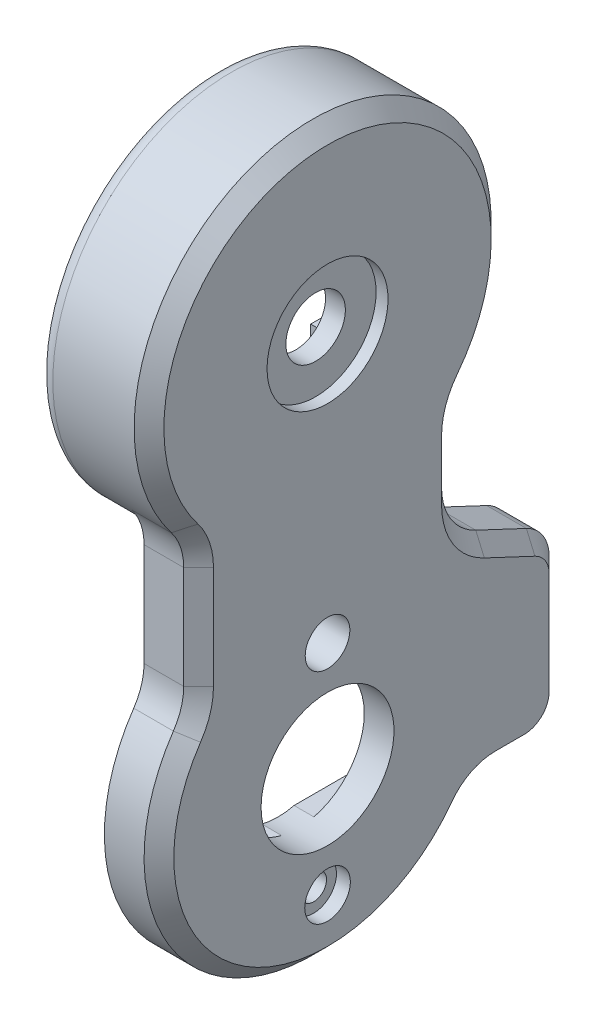
from build123d import *

# Parameters (mm, degrees)
BOSS_EXTRUDE1_START  = 55.1
BOSS_EXTRUDE1_DEPTH  = 5.5
BOSS_EXTRUDE2_START  = 55
BOSS_EXTRUDE2_DEPTH  = 0.6
BOSS_EXTRUDE3_START  = 49.4
SKETCH3_R            = 18
SKETCH3_R_2          = 16.3
BOSS_EXTRUDE3_DEPTH  = 6.2
CHAMFER1_SIZE        = 1.5
FILLET1_R            = 1.5
BOSS_EXTRUDE4_START  = -55.3
SKETCH4_W            = 2.3
SKETCH4_H            = 23
BOSS_EXTRUDE4_DEPTH  = 6.6
BOSS_EXTRUDE5_START  = -63.5
SKETCH5_W            = 2.3
SKETCH5_H            = 6.6
BOSS_EXTRUDE5_DEPTH  = 23
BOSS_EXTRUDE6_START  = 55.1
SKETCH6_R            = 4.6
BOSS_EXTRUDE6_DEPTH  = 2.3
BOSS_EXTRUDE7_START  = 59.4
SKETCH7_R            = 6.1
BOSS_EXTRUDE7_DEPTH  = 1.7
BOSS_EXTRUDE8_START  = 57.3
SKETCH8_R            = 3
BOSS_EXTRUDE8_DEPTH  = 2.2
BOSS_EXTRUDE9_START  = -52.9
SKETCH9_W            = 2.3
SKETCH9_H            = 3.4
BOSS_EXTRUDE9_DEPTH  = 1.8
BOSS_EXTRUDE10_START = -62
SKETCH10_W           = 2.3
SKETCH10_H           = 1.8
BOSS_EXTRUDE10_DEPTH = 3.4
BOSS_EXTRUDE11_START = -52.9
SKETCH11_W           = 2.3
SKETCH11_H           = 3.4
BOSS_EXTRUDE11_DEPTH = 1.8
BOSS_EXTRUDE12_START = -45.4
SKETCH12_W           = 2.3
SKETCH12_H           = 1.8
BOSS_EXTRUDE12_DEPTH = 3.4
BOSS_EXTRUDE13_START = -56
SKETCH13_W           = 6.3
SKETCH13_H           = 3.098417801
BOSS_EXTRUDE13_DEPTH = 8
BOSS_EXTRUDE14_START = -44.775
SKETCH14_W           = 4.1
SKETCH14_H           = 2
BOSS_EXTRUDE14_DEPTH = 2.9
BOSS_EXTRUDE15_START = -72.925
SKETCH15_W           = 4.1
SKETCH15_H           = 2
BOSS_EXTRUDE15_DEPTH = 2.9
BOSS_EXTRUDE16_START = -69.1
SKETCH16_W           = 2.1
SKETCH16_H           = 13
BOSS_EXTRUDE16_DEPTH = 23.4
BOSS_EXTRUDE17_START = 55.5
SKETCH17_R           = 6.7
BOSS_EXTRUDE17_DEPTH = 5.6
BOSS_EXTRUDE18_START = 55.5
SKETCH18_R           = 2.25
BOSS_EXTRUDE18_DEPTH = 5.6
BOSS_EXTRUDE19_START = 59.2
SKETCH19_R           = 2.3
BOSS_EXTRUDE19_DEPTH = 1.9
BOSS_EXTRUDE20_START = 55.5
SKETCH20_R           = 1.3
BOSS_EXTRUDE20_DEPTH = 3.75
BOSS_EXTRUDE21_START = -44.6
SKETCH21_W           = 3.1
SKETCH21_H           = 4.1
BOSS_EXTRUDE21_DEPTH = 2.2
BOSS_EXTRUDE22_START = -5.75
BOSS_EXTRUDE22_DEPTH = 3.5
BOSS_EXTRUDE23_START = -61.6
SKETCH23_W           = 3.1
SKETCH23_H           = 4.1
BOSS_EXTRUDE23_DEPTH = 2.2
BOSS_EXTRUDE24_START = -5.75
BOSS_EXTRUDE24_DEPTH = 3.5


with BuildPart() as part:
    # Sketch1 → Boss-Extrude1 (new body)
    with BuildSketch(Plane(origin=(0, 0, 0), x_dir=(0, 0, -1), z_dir=(1, 0, 0)).offset(BOSS_EXTRUDE1_START)):
        with BuildLine():
            Line((39, 3.337121701), (39, -7.038518603))
            ThreePointArc((39, -7.038518603), (38.733198515, -8.807822077), (37.956521739, -10.41977462))
            ThreePointArc((37.956521739, -10.41977462), (42.18950583, -33.883594784), (65.719936005, -30.038095238))
            ThreePointArc((65.719936005, -30.038095238), (67.138131249, -28.832955071), (68.948156242, -28.4))
            Line((68.948156242, -28.4), (71.85, -28.4))
            ThreePointArc((71.85, -28.4), (74.678427125, -27.228427125), (75.85, -24.4))
            Line((75.85, -24.4), (75.85, -14.139667829))
            ThreePointArc((75.85, -14.139667829), (75.226856881, -11.995644133), (73.551581196, -10.519637244))
            Line((73.551581196, -10.519637244), (68.447628205, -8.120544133))
            ThreePointArc((68.447628205, -8.120544133), (65.934714679, -5.9065338), (65, -2.690498257))
            Line((65, -2.690498257), (65, 3.337121701))
            ThreePointArc((65, 3.337121701), (65.321091654, 5.273613374), (66.25, 7.002841276))
            ThreePointArc((66.25, 7.002841276), (52, 36), (37.75, 7.002841276))
            ThreePointArc((37.75, 7.002841276), (38.678908346, 5.273613374), (39, 3.337121701))
        make_face()
    extrude(amount=BOSS_EXTRUDE1_DEPTH)


with BuildPart() as body_2:
    # Sketch2 → Boss-Extrude2 (new body)
    with BuildSketch(Plane(origin=(0, 0, 0), x_dir=(0, 0, -1), z_dir=(1, 0, 0)).offset(BOSS_EXTRUDE2_START)):
        with BuildLine():
            Line((39.8, 3.337121701), (39.8, -7.038518603))
            ThreePointArc((39.8, -7.038518603), (39.497624984, -9.043729207), (38.617391304, -10.870608755))
            ThreePointArc((38.617391304, -10.870608755), (42.651176143, -33.230249147), (65.074291958, -29.565714286))
            ThreePointArc((65.074291958, -29.565714286), (66.77612625, -28.119546085), (68.948156242, -27.6))
            Line((68.948156242, -27.6), (71.85, -27.6))
            ThreePointArc((71.85, -27.6), (74.1127417, -26.6627417), (75.05, -24.4))
            Line((75.05, -24.4), (75.05, -14.139667829))
            ThreePointArc((75.05, -14.139667829), (74.551485505, -12.424448872), (73.211264957, -11.243643361))
            Line((73.211264957, -11.243643361), (68.107311966, -8.84455025))
            ThreePointArc((68.107311966, -8.84455025), (65.259343303, -6.335338539), (64.2, -2.690498257))
            Line((64.2, -2.690498257), (64.2, 3.337121701))
            ThreePointArc((64.2, 3.337121701), (64.563903875, 5.531812264), (65.616666667, 7.491603886))
            ThreePointArc((65.616666667, 7.491603886), (52, 35.2), (38.383333333, 7.491603886))
            ThreePointArc((38.383333333, 7.491603886), (39.436096125, 5.531812264), (39.8, 3.337121701))
        make_face()
    extrude(amount=BOSS_EXTRUDE2_DEPTH)


with BuildPart() as part_1:
    add(part.part)

    # Combine1: cut body 2
    add(body_2.part, mode=Mode.SUBTRACT)

    # Sketch3 → Boss-Extrude3 (add)
    with BuildSketch(Plane(origin=(0, 0, 0), x_dir=(0, 0, -1), z_dir=(1, 0, 0)).offset(BOSS_EXTRUDE3_START)):
        with Locations((52, 18)):
            Circle(SKETCH3_R)
        with Locations((52, 18)):
            Circle(SKETCH3_R_2, mode=Mode.SUBTRACT)
    extrude(amount=BOSS_EXTRUDE3_DEPTH)

    # Chamfer1
    chamfer1_edges = [part_1.edges().sort_by_distance(p)[0] for p in [
        (60.6, -5.9065338, -65.934714679),
        (60.6, 0.323311722, -65),
        (60.6, -9.320090689, -70.999604701),
        (60.6, 5.273613374, -65.321091654),
        (60.6, -11.995644133, -75.226856881),
        (60.6, 36, -52),
        (60.6, -19.269833914, -75.85),
        (60.6, 5.273613374, -38.678908346),
        (60.6, -27.228427125, -74.678427125),
        (60.6, -1.850698451, -39),
        (60.6, -28.4, -70.399078121),
        (60.6, -8.807822077, -38.733198515),
        (60.6, -28.832955071, -67.138131249),
        (60.6, -33.883594784, -42.18950583),
    ]]
    chamfer(chamfer1_edges, length=CHAMFER1_SIZE)

    # Fillet1
    fillet1_edges = [part_1.edges().sort_by_distance(p)[0] for p in [
        (49.4, 18, -34),
    ]]
    fillet(fillet1_edges, radius=FILLET1_R)


with BuildPart() as body_2_2:
    # Sketch4 → Boss-Extrude4 (new body)
    with BuildSketch(Plane.XY.offset(BOSS_EXTRUDE4_START)):
        with Locations((56.25, 18)):
            Rectangle(SKETCH4_W, SKETCH4_H)
    extrude(amount=BOSS_EXTRUDE4_DEPTH)


with BuildPart() as part_2:
    add(part_1.part)

    # Combine2: cut body 2 2
    add(body_2_2.part, mode=Mode.SUBTRACT)


with BuildPart() as body_2_3:
    # Sketch5 → Boss-Extrude5 (new body)
    with BuildSketch(Plane.XY.offset(BOSS_EXTRUDE5_START)):
        with Locations((56.25, 18)):
            Rectangle(SKETCH5_W, SKETCH5_H)
    extrude(amount=BOSS_EXTRUDE5_DEPTH)


with BuildPart() as part_3:
    add(part_2.part)

    # Combine3: cut body 2 3
    add(body_2_3.part, mode=Mode.SUBTRACT)


with BuildPart() as body_2_4:
    # Sketch6 → Boss-Extrude6 (new body)
    with BuildSketch(Plane(origin=(0, 0, 0), x_dir=(0, 0, -1), z_dir=(1, 0, 0)).offset(BOSS_EXTRUDE6_START)):
        with Locations((52, 18)):
            Circle(SKETCH6_R)
    extrude(amount=BOSS_EXTRUDE6_DEPTH)


with BuildPart() as part_4:
    add(part_3.part)

    # Combine4: cut body 2 4
    add(body_2_4.part, mode=Mode.SUBTRACT)


with BuildPart() as body_2_5:
    # Sketch7 → Boss-Extrude7 (new body)
    with BuildSketch(Plane(origin=(0, 0, 0), x_dir=(0, 0, -1), z_dir=(1, 0, 0)).offset(BOSS_EXTRUDE7_START)):
        with Locations((52, 18)):
            Circle(SKETCH7_R)
    extrude(amount=BOSS_EXTRUDE7_DEPTH)


with BuildPart() as part_5:
    add(part_4.part)

    # Combine5: cut body 2 5
    add(body_2_5.part, mode=Mode.SUBTRACT)


with BuildPart() as body_2_6:
    # Sketch8 → Boss-Extrude8 (new body)
    with BuildSketch(Plane(origin=(0, 0, 0), x_dir=(0, 0, -1), z_dir=(1, 0, 0)).offset(BOSS_EXTRUDE8_START)):
        with Locations((52, 18)):
            Circle(SKETCH8_R)
    extrude(amount=BOSS_EXTRUDE8_DEPTH)


with BuildPart() as part_6:
    add(part_5.part)

    # Combine6: cut body 2 6
    add(body_2_6.part, mode=Mode.SUBTRACT)


with BuildPart() as body_2_7:
    # Sketch9 → Boss-Extrude9 (new body)
    with BuildSketch(Plane.XY.offset(BOSS_EXTRUDE9_START)):
        with Locations((58.45, 26.3)):
            Rectangle(SKETCH9_W, SKETCH9_H)
    extrude(amount=BOSS_EXTRUDE9_DEPTH)


with BuildPart() as part_7:
    add(part_6.part)

    # Combine7: cut body 2 7
    add(body_2_7.part, mode=Mode.SUBTRACT)


with BuildPart() as body_2_8:
    # Sketch10 → Boss-Extrude10 (new body)
    with BuildSketch(Plane.XY.offset(BOSS_EXTRUDE10_START)):
        with Locations((58.45, 18)):
            Rectangle(SKETCH10_W, SKETCH10_H)
    extrude(amount=BOSS_EXTRUDE10_DEPTH)


with BuildPart() as part_8:
    add(part_7.part)

    # Combine8: cut body 2 8
    add(body_2_8.part, mode=Mode.SUBTRACT)


with BuildPart() as body_2_9:
    # Sketch11 → Boss-Extrude11 (new body)
    with BuildSketch(Plane.XY.offset(BOSS_EXTRUDE11_START)):
        with Locations((58.45, 9.7)):
            Rectangle(SKETCH11_W, SKETCH11_H)
    extrude(amount=BOSS_EXTRUDE11_DEPTH)


with BuildPart() as part_9:
    add(part_8.part)

    # Combine9: cut body 2 9
    add(body_2_9.part, mode=Mode.SUBTRACT)


with BuildPart() as body_2_10:
    # Sketch12 → Boss-Extrude12 (new body)
    with BuildSketch(Plane.XY.offset(BOSS_EXTRUDE12_START)):
        with Locations((58.45, 18)):
            Rectangle(SKETCH12_W, SKETCH12_H)
    extrude(amount=BOSS_EXTRUDE12_DEPTH)


with BuildPart() as part_10:
    add(part_9.part)

    # Combine10: cut body 2 10
    add(body_2_10.part, mode=Mode.SUBTRACT)


with BuildPart() as body_2_11:
    # Sketch13 → Boss-Extrude13 (new body)
    with BuildSketch(Plane.XY.offset(BOSS_EXTRUDE13_START)):
        with Locations((52.45, 0.9492089)):
            Rectangle(SKETCH13_W, SKETCH13_H)
    extrude(amount=BOSS_EXTRUDE13_DEPTH)


with BuildPart() as part_11:
    add(part_10.part)

    # Combine11: cut body 2 11
    add(body_2_11.part, mode=Mode.SUBTRACT)


with BuildPart() as body_2_12:
    # Sketch14 → Boss-Extrude14 (new body)
    with BuildSketch(Plane.XY.offset(BOSS_EXTRUDE14_START)):
        with Locations((57.55, -20)):
            Rectangle(SKETCH14_W, SKETCH14_H)
    extrude(amount=BOSS_EXTRUDE14_DEPTH)


with BuildPart() as part_12:
    add(part_11.part)

    # Combine12: cut body 2 12
    add(body_2_12.part, mode=Mode.SUBTRACT)


with BuildPart() as body_2_13:
    # Sketch15 → Boss-Extrude15 (new body)
    with BuildSketch(Plane.XY.offset(BOSS_EXTRUDE15_START)):
        with Locations((57.55, -20)):
            Rectangle(SKETCH15_W, SKETCH15_H)
    extrude(amount=BOSS_EXTRUDE15_DEPTH)


with BuildPart() as part_13:
    add(part_12.part)

    # Combine13: cut body 2 13
    add(body_2_13.part, mode=Mode.SUBTRACT)


with BuildPart() as body_2_14:
    # Sketch16 → Boss-Extrude16 (new body)
    with BuildSketch(Plane.XY.offset(BOSS_EXTRUDE16_START)):
        with Locations((56.55, -20)):
            Rectangle(SKETCH16_W, SKETCH16_H)
    extrude(amount=BOSS_EXTRUDE16_DEPTH)


with BuildPart() as part_14:
    add(part_13.part)

    # Combine14: cut body 2 14
    add(body_2_14.part, mode=Mode.SUBTRACT)


with BuildPart() as body_2_15:
    # Sketch17 → Boss-Extrude17 (new body)
    with BuildSketch(Plane(origin=(0, 0, 0), x_dir=(0, 0, -1), z_dir=(1, 0, 0)).offset(BOSS_EXTRUDE17_START)):
        with Locations((52, -20)):
            Circle(SKETCH17_R)
    extrude(amount=BOSS_EXTRUDE17_DEPTH)


with BuildPart() as part_15:
    add(part_14.part)

    # Combine15: cut body 2 15
    add(body_2_15.part, mode=Mode.SUBTRACT)


with BuildPart() as body_2_16:
    # Sketch18 → Boss-Extrude18 (new body)
    with BuildSketch(Plane(origin=(0, 0, 0), x_dir=(0, 0, -1), z_dir=(1, 0, 0)).offset(BOSS_EXTRUDE18_START)):
        with Locations((52, -9)):
            Circle(SKETCH18_R)
    extrude(amount=BOSS_EXTRUDE18_DEPTH)


with BuildPart() as part_16:
    add(part_15.part)

    # Combine16: cut body 2 16
    add(body_2_16.part, mode=Mode.SUBTRACT)


with BuildPart() as body_2_17:
    # Sketch19 → Boss-Extrude19 (new body)
    with BuildSketch(Plane(origin=(0, 0, 0), x_dir=(0, 0, -1), z_dir=(1, 0, 0)).offset(BOSS_EXTRUDE19_START)):
        with Locations((52, -31)):
            Circle(SKETCH19_R)
    extrude(amount=BOSS_EXTRUDE19_DEPTH)


with BuildPart() as part_17:
    add(part_16.part)

    # Combine17: cut body 2 17
    add(body_2_17.part, mode=Mode.SUBTRACT)


with BuildPart() as body_2_18:
    # Sketch20 → Boss-Extrude20 (new body)
    with BuildSketch(Plane(origin=(0, 0, 0), x_dir=(0, 0, -1), z_dir=(1, 0, 0)).offset(BOSS_EXTRUDE20_START)):
        with Locations((52, -31)):
            Circle(SKETCH20_R)
    extrude(amount=BOSS_EXTRUDE20_DEPTH)


with BuildPart() as part_18:
    add(part_17.part)

    # Combine18: cut body 2 18
    add(body_2_18.part, mode=Mode.SUBTRACT)


with BuildPart() as body_2_19:
    # Sketch21 → Boss-Extrude21 (new body)
    with BuildSketch(Plane.XY.offset(BOSS_EXTRUDE21_START)):
        with Locations((57.05, -4)):
            Rectangle(SKETCH21_W, SKETCH21_H)
    extrude(amount=BOSS_EXTRUDE21_DEPTH)


with BuildPart() as part_19:
    add(part_18.part)

    # Combine19: cut body 2 19
    add(body_2_19.part, mode=Mode.SUBTRACT)

    # Sketch22 → Boss-Extrude22 (add)
    with BuildSketch(Plane(origin=(0, 0, 0), x_dir=(1, 0, 0), z_dir=(0, 1, 0)).offset(BOSS_EXTRUDE22_START)):
        Polygon((58.8, 44), (58.8, 43), (52.8, 43), (52.8, 42.6), (52.2, 42.6), (51.4, 43.4), (51.4, 44), align=None)
    extrude(amount=BOSS_EXTRUDE22_DEPTH)


with BuildPart() as body_2_20:
    # Sketch23 → Boss-Extrude23 (new body)
    with BuildSketch(Plane.XY.offset(BOSS_EXTRUDE23_START)):
        with Locations((57.05, -4)):
            Rectangle(SKETCH23_W, SKETCH23_H)
    extrude(amount=BOSS_EXTRUDE23_DEPTH)


with BuildPart() as part_20:
    add(part_19.part)

    # Combine20: cut body 2 20
    add(body_2_20.part, mode=Mode.SUBTRACT)

    # Sketch24 → Boss-Extrude24 (add)
    with BuildSketch(Plane(origin=(0, 0, 0), x_dir=(1, 0, 0), z_dir=(0, 1, 0)).offset(BOSS_EXTRUDE24_START)):
        Polygon((58.8, 60), (58.8, 61), (52.8, 61), (52.8, 61.4), (52.2, 61.4), (51.4, 60.6), (51.4, 60), align=None)
    extrude(amount=BOSS_EXTRUDE24_DEPTH)


solid = part_20.part
